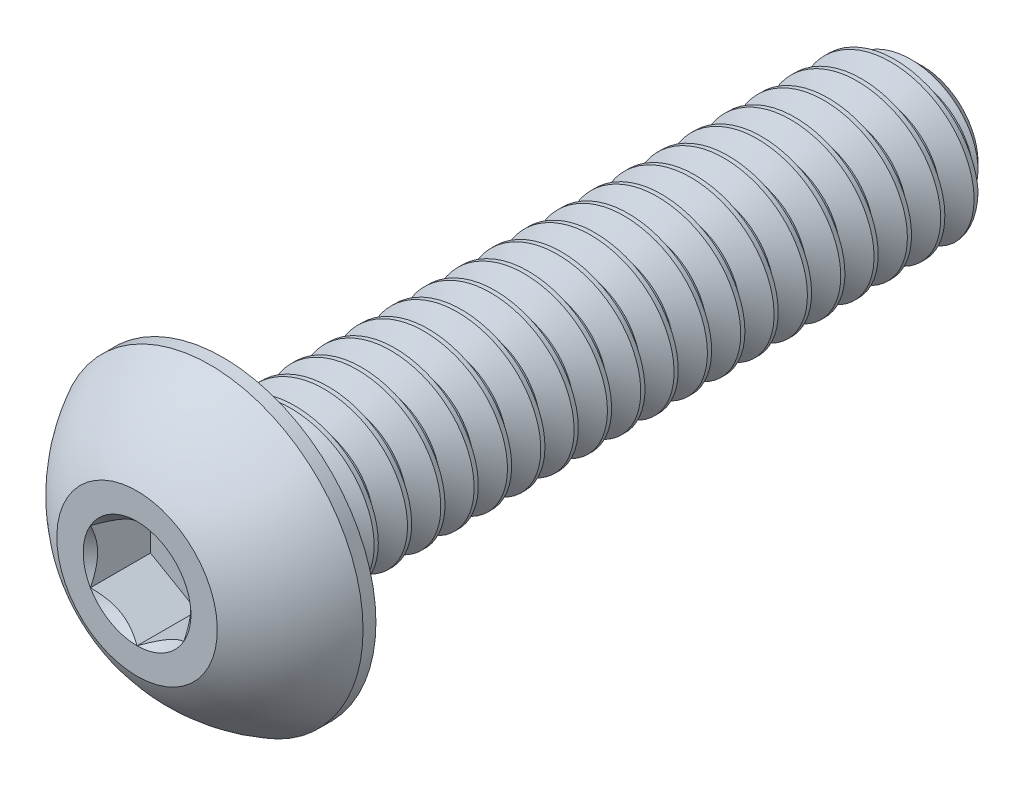
from build123d import *

# Parameters (mm, degrees)
SKETCH1_W          = 9.525
SKETCH1_H          = 1.0922
CHAMFER1_SIZE      = 0.340178571
CUT_SWEEP1_PITCH   = 0.453571429
CUT_EXTRUDE2_DEPTH = 0.81788


with BuildPart() as part:
    # Sketch1 → Revolve1 (revolve)
    with BuildSketch(Plane(origin=(0, 0, 0), x_dir=(0, 0, -1), z_dir=(1, 0, 0))):
        with Locations((5.9309, 0.5461)):
            Rectangle(SKETCH1_W, SKETCH1_H)
    revolve(axis=Axis((0, 0, -10.6934), (0, 0, 1)))

    # Chamfer1
    chamfer1_edges = [part.edges().sort_by_distance(p)[0] for p in [
        (0, -1.0922, -10.6934),
    ]]
    chamfer(chamfer1_edges, length=CHAMFER1_SIZE)

    # Cut-Sweep1: the profile of Sketch2 profile screwed along a right-hand helix of 23.576 turns, 6 arcs to a turn; built about Z, then put on its axis
    cut_sweep1_z = Axis((0, 0, 0), (0, 0, 1))
    cut_sweep1_corners = [(1.0925, 0, 0.000173205), (1.0925, 0, -0.397048205), (0.797596715, 0, -0.226785714), (0.797596715, 0, -0.170089286)]
    with BuildLine(mode=Mode.PRIVATE) as cut_sweep1_profile:
        Line(cut_sweep1_corners[0], cut_sweep1_corners[1])
        Line(cut_sweep1_corners[1], cut_sweep1_corners[2])
        Line(cut_sweep1_corners[2], cut_sweep1_corners[3])
        Line(cut_sweep1_corners[3], cut_sweep1_corners[0])
    cut_sweep1_cap = Face(cut_sweep1_profile.wire())
    cut_sweep1_turn_angles = [0, 30, 60, 90, 120, 150, 180, 210, 240, 270, 300, 330, 360]
    cut_sweep1_turn_weights = [1, 0.8660254037844387, 1, 0.8660254037844387, 1, 0.8660254037844387, 1, 0.8660254037844387, 1, 0.8660254037844387, 1, 0.8660254037844387, 1]
    cut_sweep1_turn_rails = [Edge.make_bspline([Vector(p[0], p[1], 0).rotate(cut_sweep1_z, cut_sweep1_turn_angles[k]) / cut_sweep1_turn_weights[k] + Vector(0, 0, p[2] + CUT_SWEEP1_PITCH * cut_sweep1_turn_angles[k] / 360) for k in range(13)], [0, 0, 0, 1, 1, 2, 2, 3, 3, 4, 4, 5, 5, 6, 6, 6], 2, cut_sweep1_turn_weights) for p in cut_sweep1_corners]
    cut_sweep1_turn_sides = [Face.make_surface_from_curves(cut_sweep1_turn_rails[p[0]], cut_sweep1_turn_rails[p[1]]) for p in [(0, 1), (1, 2), (2, 3), (3, 0)]]
    cut_sweep1_last_angles = [8280, 8310, 8340, 8370, 8400, 8430, 8460, 8473.68, 8487.36]
    cut_sweep1_last_weights = [1, 0.8660254037844387, 1, 0.8660254037844387, 1, 0.8660254037844387, 1, 0.9716317329143874, 1]
    cut_sweep1_last_rails = [Edge.make_bspline([Vector(p[0], p[1], 0).rotate(cut_sweep1_z, cut_sweep1_last_angles[k]) / cut_sweep1_last_weights[k] + Vector(0, 0, p[2] + CUT_SWEEP1_PITCH * cut_sweep1_last_angles[k] / 360) for k in range(9)], [0, 0, 0, 1, 1, 2, 2, 3, 3, 4, 4, 4], 2, cut_sweep1_last_weights) for p in cut_sweep1_corners]
    cut_sweep1_last_sides = [Face.make_surface_from_curves(cut_sweep1_last_rails[p[0]], cut_sweep1_last_rails[p[1]]) for p in [(0, 1), (1, 2), (2, 3), (3, 0)]]
    cut_sweep1 = Plane(origin=(0, 0, -10.6934), x_dir=(0, 1, 0), z_dir=(0, 0, 1)) * Solid(Shell([*[p.moved(Location((0, 0, CUT_SWEEP1_PITCH * i))) for i in range(23) for p in cut_sweep1_turn_sides], *cut_sweep1_last_sides, cut_sweep1_cap, cut_sweep1_cap.rotate(cut_sweep1_z, 8487.36).moved(Location((0, 0, CUT_SWEEP1_PITCH * 8487.36 / 360)))]))
    add(cut_sweep1, mode=Mode.SUBTRACT)

    # Sketch7 → Revolve2 (revolve)
    with BuildSketch(Plane(origin=(0, 0, 0), x_dir=(0, 0, -1), z_dir=(1, 0, 0)), mode=Mode.PRIVATE) as revolve2_sk:
        with BuildLine():
            Line((0.99314, 2.0828), (1.1684, 2.0828))
            Line((1.1684, 2.0828), (1.1684, 0))
            Line((1.1684, 0), (0, 0))
            Line((0, 0), (0, 1.0922))
            ThreePointArc((0, 1.0922), (0.420912553, 1.663351441), (0.99314, 2.0828))
        make_face()
    revolve(revolve2_sk.sketch.rotate(Axis((0, 0, 0), (0, 0, -1)), 189.336081704), axis=Axis((0, 0, 0), (0, 0, -1)))

    # Sketch5 → Cut-Extrude2 (cut)
    with BuildSketch(Plane.XY):
        Polygon((0.635, -0.366617421), (0.635, 0.366617421), (0, 0.733234842), (-0.635, 0.366617421), (-0.635, -0.366617421), (0, -0.733234842), align=None)
    extrude(amount=-CUT_EXTRUDE2_DEPTH, mode=Mode.SUBTRACT)

    # Cut-Extrude3 cone 1 section (through the dimple's axis) → Cut-Extrude3 (revolve, cut)
    with BuildSketch(Plane(origin=(0, 0, 0), x_dir=(0, -1, 0), z_dir=(1, 0, 0))):
        Polygon((0, 0), (0.733234842, 0), (0, 0.733234842), align=None)
    revolve(axis=Axis((0, 0, 0), (0, 0, -1)), mode=Mode.SUBTRACT)


solid = part.part
